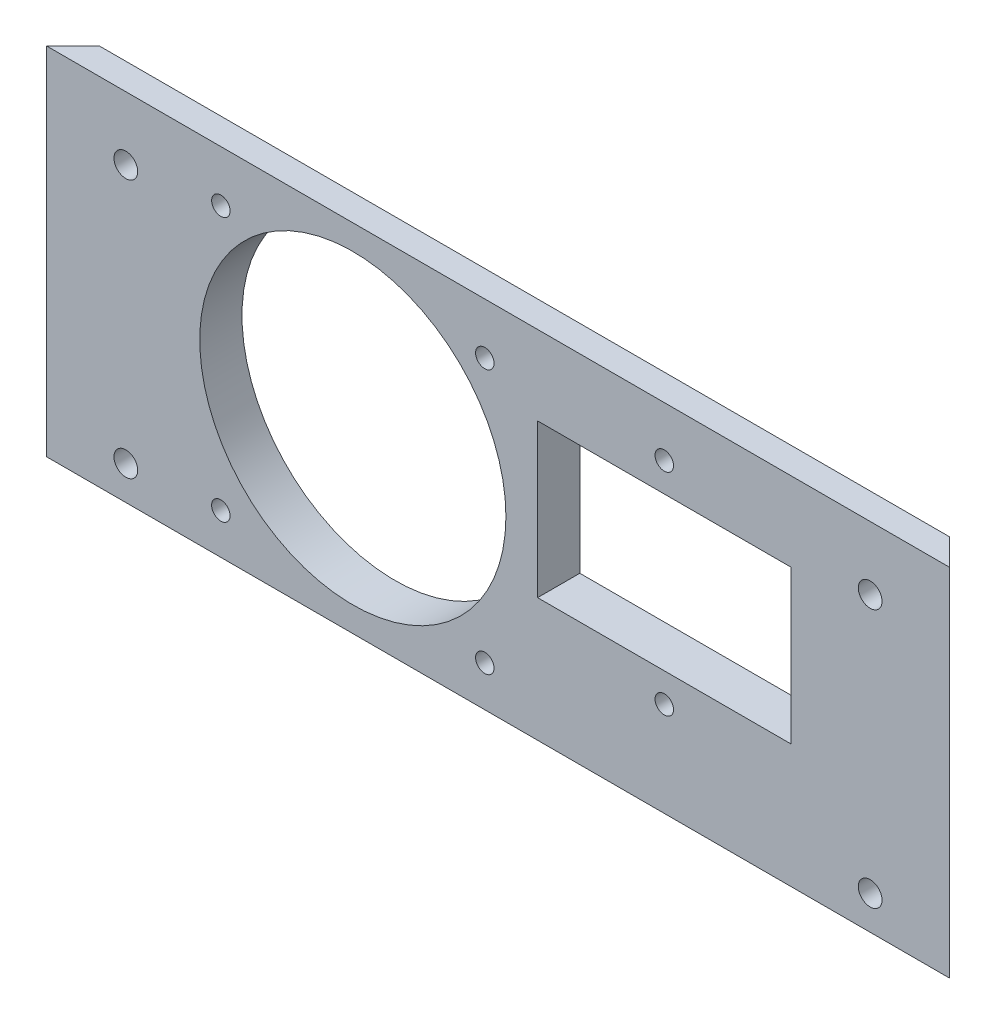
from build123d import *

# Parameters (mm, degrees)
SKETCH1_W           = 171
SKETCH1_H           = 70
SKETCH1_R           = 2.25
BOSS_EXTRUDE1_DEPTH = 5
SKETCH2_W           = 171
SKETCH2_H           = 65
SKETCH2_R           = 2.25
BOSS_EXTRUDE2_DEPTH = 3
CHAMFER1_SIZE       = 8
CHAMFER3_SIZE       = 3
SKETCH3_W           = 7.071067812
SKETCH3_H           = 2.6
CUT_EXTRUDE1_DEPTH  = 199.002168661
SKETCH4_R           = 29
SKETCH4_R_2         = 1.75
SKETCH4_W           = 48
SKETCH4_H           = 29
CUT_EXTRUDE2_DEPTH  = 185.945938047


with BuildPart() as part:
    # Sketch1 → Boss-Extrude1 (new body)
    with BuildSketch(Plane.XY):
        with Locations((85.5, 35)):
            Rectangle(SKETCH1_W, SKETCH1_H)
        with Locations((15, 9)):
            Circle(SKETCH1_R, mode=Mode.SUBTRACT)
        with Locations(Location((156, 9, 0), (0, 0, 180))):
            Circle(SKETCH1_R, mode=Mode.SUBTRACT)
        with Locations((15, 58)):
            Circle(SKETCH1_R, mode=Mode.SUBTRACT)
        with Locations(Location((156, 58, 0), (0, 0, 180))):
            Circle(SKETCH1_R, mode=Mode.SUBTRACT)
    extrude(amount=-BOSS_EXTRUDE1_DEPTH)

    # Sketch2 → Boss-Extrude2 (add)
    with BuildSketch(Plane(origin=(0, 0, -5), x_dir=(-1, 0, 0), z_dir=(0, 0, -1))):
        with Locations((-85.5, 37.5)):
            Rectangle(SKETCH2_W, SKETCH2_H)
        with Locations(Location((-15, 9, 0), (0, 0, 180))):
            Circle(SKETCH2_R, mode=Mode.SUBTRACT)
        with Locations((-156, 9)):
            Circle(SKETCH2_R, mode=Mode.SUBTRACT)
        with Locations(Location((-15, 58, 0), (0, 0, 180))):
            Circle(SKETCH2_R, mode=Mode.SUBTRACT)
        with Locations((-156, 58)):
            Circle(SKETCH2_R, mode=Mode.SUBTRACT)
    extrude(amount=BOSS_EXTRUDE2_DEPTH)

    # Chamfer1
    # the kernel refuses this chamfer: 8 mm, written as the material it takes off along each edge
    with BuildSketch(Plane(origin=(171, -15.573463904, -8), x_dir=(-0.9996219169112968, 0, -0.027495876610586296), z_dir=(0, 1, 0)), Plane(origin=(0, 90.573463904, -8), x_dir=(0.9996219169112968, 0, -0.027495876610586275), z_dir=(0, -1, 0))) as chamfer1_piece_1:
        Polygon((CHAMFER1_SIZE * 0.999621916911, CHAMFER1_SIZE * 0.0274958766106), (-CHAMFER1_SIZE * 0.0274958766106, CHAMFER1_SIZE * 0.999621916911), (0, 0), align=None)
    extrude(amount=106.146927807, mode=Mode.SUBTRACT)

    # Chamfer3
    chamfer3_edges = [part.edges().sort_by_distance(p)[0] for p in [
        (85.5, 70, -8),
    ]]
    chamfer(chamfer3_edges, length=CHAMFER3_SIZE)

    # Sketch3 → Cut-Extrude1 (cut, through all, along a direction that is not the sketch's normal)
    with BuildSketch(Plane(origin=(85.5, 0, -85.5), x_dir=(-0.7071067811865452, 0, -0.7071067811865498), z_dir=(0.7071067811865498, 0, -0.7071067811865452))):
        with Locations((-117.379725677, 1.3)):
            Rectangle(SKETCH3_W, SKETCH3_H)
    extrude(amount=-CUT_EXTRUDE1_DEPTH, dir=(1, 0, 0), mode=Mode.SUBTRACT)

    # Sketch4 → Cut-Extrude2 (cut, through all)
    with BuildSketch(Plane.XY):
        with Locations((58, 36.3)):
            Circle(SKETCH4_R)
        with Locations((33, 60.3)):
            Circle(SKETCH4_R_2)
        with Locations((83, 60.3)):
            Circle(SKETCH4_R_2)
        with Locations((83, 10.3)):
            Circle(SKETCH4_R_2)
        with Locations((33, 10.3)):
            Circle(SKETCH4_R_2)
        with Locations((117, 60.5)):
            Circle(SKETCH4_R_2)
        with Locations((117, 20.5)):
            Circle(SKETCH4_R_2)
        with Locations((117, 40.5)):
            Rectangle(SKETCH4_W, SKETCH4_H)
    extrude(amount=-CUT_EXTRUDE2_DEPTH, mode=Mode.SUBTRACT)


solid = part.part
